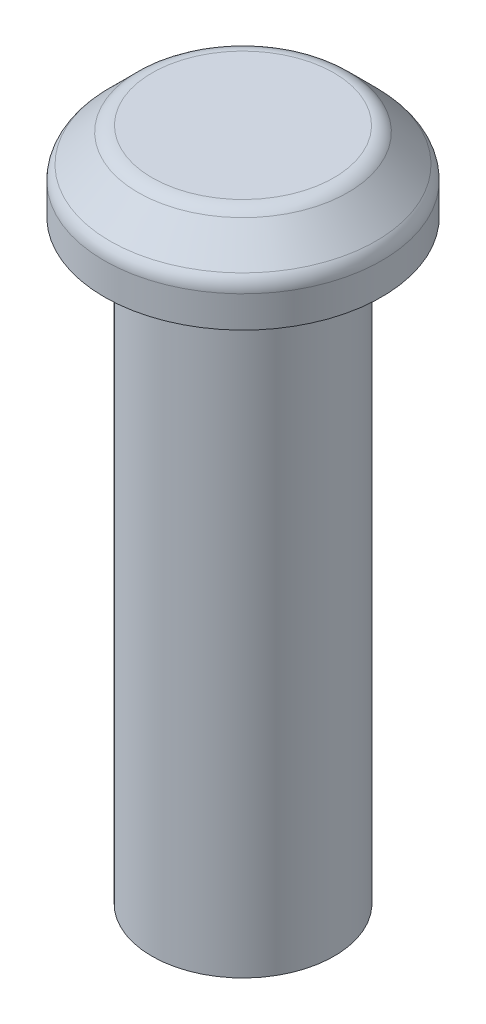
from build123d import *

# Parameters (mm, degrees)
SKETCH1_R           = 2.3
BOSS_EXTRUDE1_DEPTH = 15
SKETCH2_R           = 3.5
BOSS_EXTRUDE2_DEPTH = 2
CHAMFER1_SIZE       = 1
FILLET1_R           = 0.5


with BuildPart() as part:
    # Sketch1 → Boss-Extrude1 (new body)
    with BuildSketch(Plane(origin=(0, 0, 0), x_dir=(1, 0, 0), z_dir=(0, 1, 0))):
        Circle(SKETCH1_R)
    extrude(amount=BOSS_EXTRUDE1_DEPTH)

    # Sketch2 → Boss-Extrude2 (add)
    with BuildSketch(Plane(origin=(0, 15, 0), x_dir=(1, 0, 0), z_dir=(0, 1, 0))):
        Circle(SKETCH2_R)
    extrude(amount=BOSS_EXTRUDE2_DEPTH)

    # Chamfer1
    chamfer1_edges = [part.edges().sort_by_distance(p)[0] for p in [
        (-3.5, 17, 0),
    ]]
    chamfer(chamfer1_edges, length=CHAMFER1_SIZE)

    # Fillet1
    fillet1_edges = [part.edges().sort_by_distance(p)[0] for p in [
        (-3.5, 16, 0),
        (-2.5, 17, 0),
    ]]
    fillet(fillet1_edges, radius=FILLET1_R)


solid = part.part
